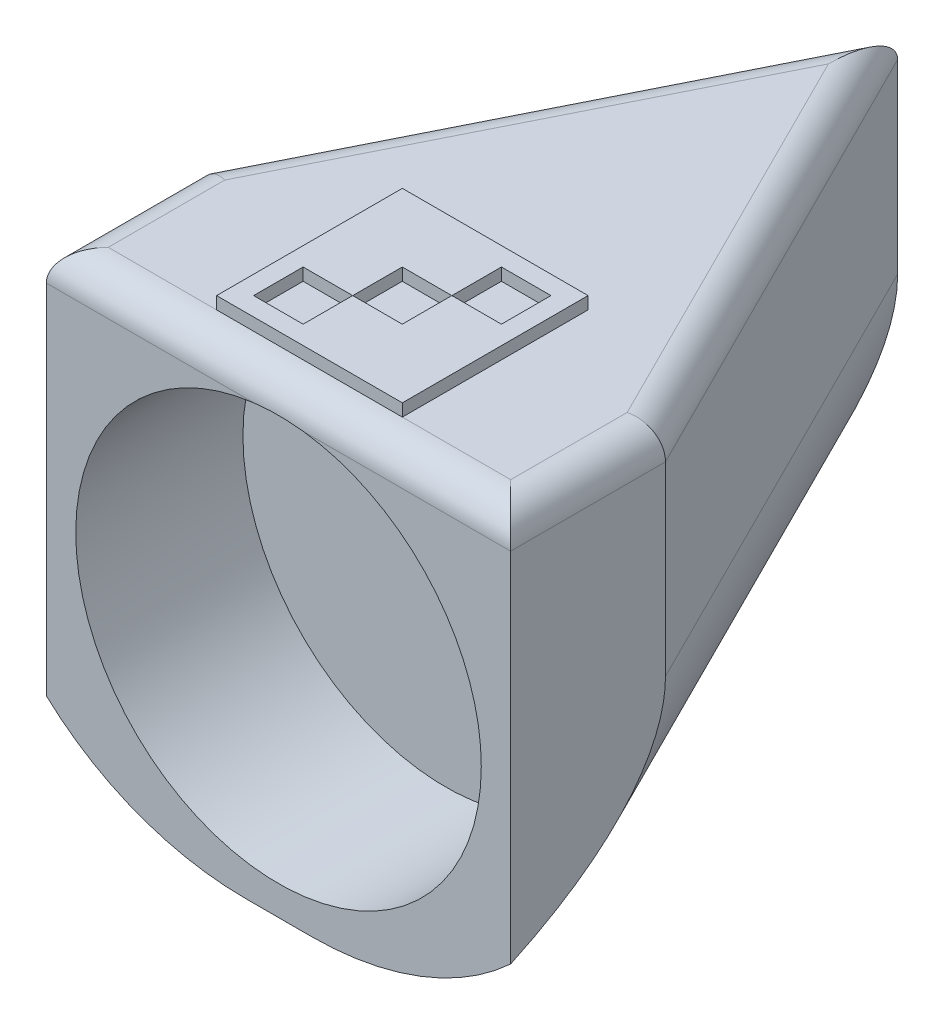
from build123d import *

# Parameters (mm, degrees)
CROQUIS1_W              = 37.5
CROQUIS1_H              = 25
SALIENTE_EXTRUIR1_DEPTH = 75
CROQUIS3_R              = 32.75
CORTAR_EXTRUIR2_DEPTH   = 27
REDONDEO4_R             = 40
REDONDEO5_R             = 5
CROQUIS4_W              = 30
CROQUIS4_H              = 30
SALIENTE_EXTRUIR2_DEPTH = 2
CROQUIS5_W              = 8
CROQUIS5_H              = 8
CORTAR_EXTRUIR10_DEPTH  = 2


with BuildPart() as part:
    # Croquis1 → Saliente-Extruir1 (new body)
    with BuildSketch(Plane(origin=(0, 0, 0), x_dir=(1, 0, 0), z_dir=(0, 1, 0))):
        Polygon((0, 0), (-37.5, -75), (0, -75), align=None)
        Polygon((37.5, -75), (0, 0), (0, -75), align=None)
        with Locations((18.75, -87.5)):
            Rectangle(CROQUIS1_W, CROQUIS1_H)
        with Locations((-18.75, -87.5)):
            Rectangle(CROQUIS1_W, CROQUIS1_H)
    extrude(amount=SALIENTE_EXTRUIR1_DEPTH)

    # Croquis3 → Cortar-Extruir2 (cut)
    with BuildSketch(Plane.XY.offset(100)):
        with Locations((0, 37.5)):
            Circle(CROQUIS3_R)
    extrude(amount=-CORTAR_EXTRUIR2_DEPTH, mode=Mode.SUBTRACT)

    # Redondeo4
    redondeo4_edges = [part.edges().sort_by_distance(p)[0] for p in [
        (-18.75, 0, 37.5),
        (18.75, 0, 37.5),
    ]]
    fillet(redondeo4_edges, radius=REDONDEO4_R)

    # Redondeo5
    # the kernel refuses this fillet: 5 mm, written as the material it takes off along each edge
    with BuildSketch(Plane(origin=(37.5, 75, 112.5), x_dir=(-1, 0, 0), z_dir=(0, 0, -1)), Plane(origin=(-37.5, 75, 62.5), x_dir=(1, 0, 0), z_dir=(0, 0, 1))) as redondeo5_piece_1:
        with BuildLine():
            CenterArc((REDONDEO5_R, -REDONDEO5_R), REDONDEO5_R, 90, 90)
            Line((0, -REDONDEO5_R), (0, 0))
            Line((0, 0), (REDONDEO5_R, 0))
        make_face()
    extrude(amount=50, mode=Mode.SUBTRACT)
    with BuildSketch(Plane(origin=(43.090169944, 75, 86.180339887), x_dir=(0, -1, 0), z_dir=(-0.4472135954999581, 0, -0.8944271909999159)), Plane(origin=(5.590169944, 75, -11.180339887), x_dir=(0, -1, 0), z_dir=(-0.44721359549995776, 0, 0.894427190999916))) as redondeo5_piece_2:
        with BuildLine():
            CenterArc((REDONDEO5_R, REDONDEO5_R), REDONDEO5_R, 180, 90)
            Line((0, REDONDEO5_R), (0, 0))
            Line((0, 0), (REDONDEO5_R, 0))
        make_face()
    extrude(amount=108.852549156, mode=Mode.SUBTRACT)
    with BuildSketch(Plane(origin=(-50, 75, 100), x_dir=(0, 0, -1), z_dir=(1, 0, 0))) as redondeo5_piece_3:
        with BuildLine():
            CenterArc((REDONDEO5_R, -REDONDEO5_R), REDONDEO5_R, 90, 90)
            Line((0, -REDONDEO5_R), (0, 0))
            Line((0, 0), (REDONDEO5_R, 0))
        make_face()
    extrude(amount=100, mode=Mode.SUBTRACT)

    # Croquis4 → Saliente-Extruir2 (add)
    with BuildSketch(Plane(origin=(0, 75, 0), x_dir=(1, 0, 0), z_dir=(0, 1, 0))):
        with Locations((0, -80)):
            Rectangle(CROQUIS4_W, CROQUIS4_H)
    extrude(amount=SALIENTE_EXTRUIR2_DEPTH)

    # Croquis5 → Cortar-Extruir10 (cut)
    with BuildSketch(Plane(origin=(0, 77, 0), x_dir=(1, 0, 0), z_dir=(0, 1, 0))):
        with Locations((-8.012274888, -88.012274888)):
            Rectangle(CROQUIS5_W, CROQUIS5_H)
        with Locations((8.001867248, -71.998132752)):
            Rectangle(CROQUIS5_W, CROQUIS5_H)
        with Locations((-0.00520382, -80.00520382)):
            Rectangle(CROQUIS5_W, CROQUIS5_H)
    extrude(amount=-CORTAR_EXTRUIR10_DEPTH, mode=Mode.SUBTRACT)


solid = part.part
